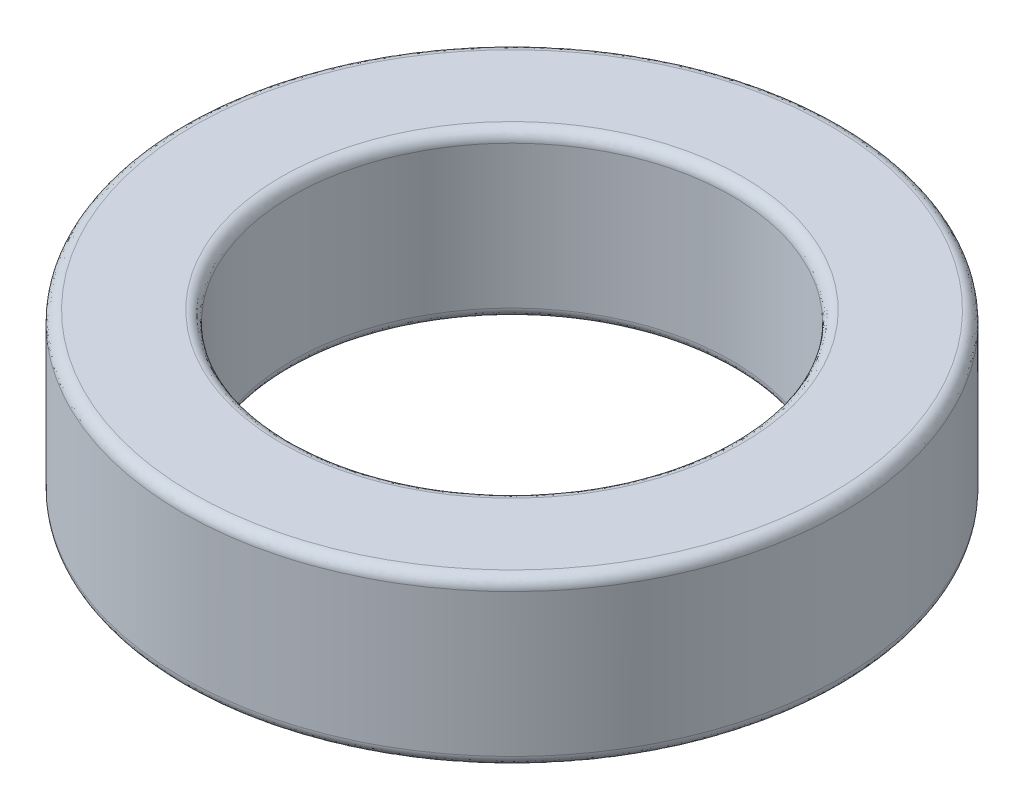
from build123d import *

# Parameters (mm, degrees)
SKETCH1_R           = 30
SKETCH1_R_2         = 20
BOSS_EXTRUDE1_DEPTH = 15
FILLET1_R           = 1


with BuildPart() as part:
    # Sketch1 → Boss-Extrude1 (new body)
    with BuildSketch(Plane(origin=(0, 0, 0), x_dir=(1, 0, 0), z_dir=(0, 1, 0))):
        Circle(SKETCH1_R)
        Circle(SKETCH1_R_2, mode=Mode.SUBTRACT)
    extrude(amount=BOSS_EXTRUDE1_DEPTH)

    # Fillet1
    fillet1_edges = [part.edges().sort_by_distance(p)[0] for p in [
        (-30, 0, 0),
        (-30, 15, 0),
        (-20, 0, 0),
        (-20, 15, 0),
    ]]
    fillet(fillet1_edges, radius=FILLET1_R)


solid = part.part
